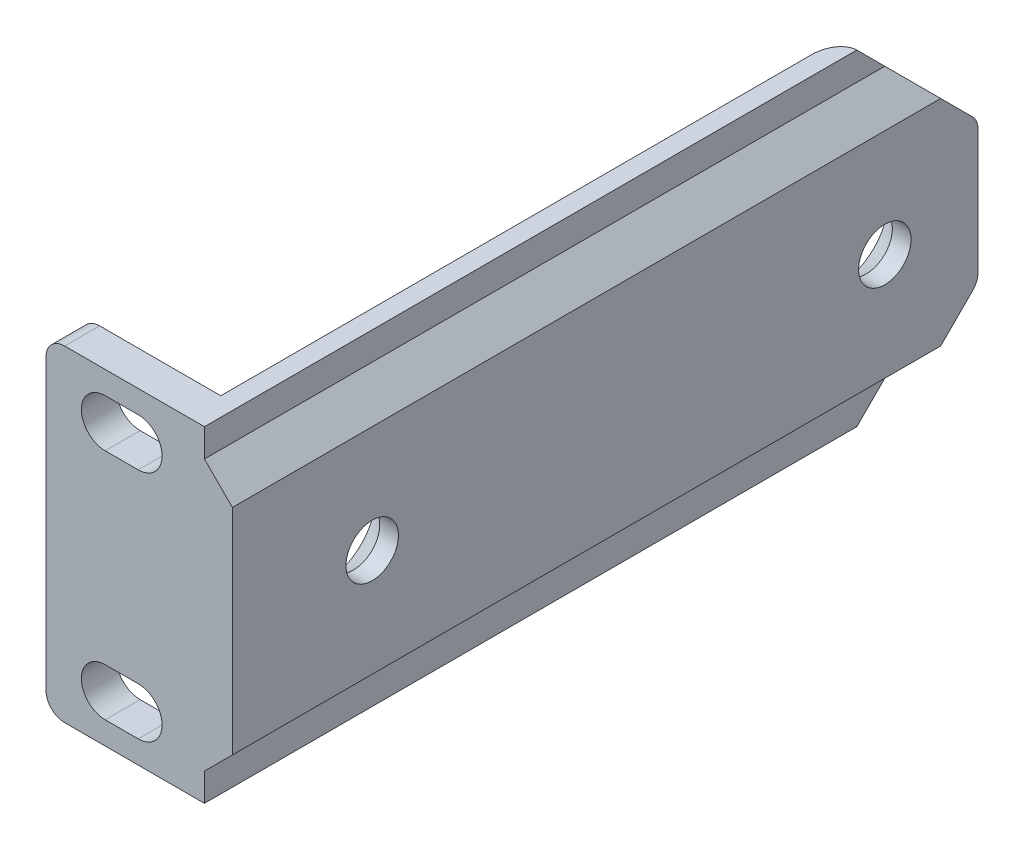
from build123d import *

# Parameters (mm, degrees)
BOSS_EXTRUDE1_DEPTH                           = 22.225
SKETCH2_W                                     = 3.81
SKETCH2_H                                     = 3.81
CUT_EXTRUDE1_DEPTH                            = 108.059192156
CUT_EXTRUDE2_DEPTH                            = 108.059192156
FILLET1_R                                     = 2.54
CSK_FOR_1_4_FLAT_HEAD_MACHINE_SCREW1_AT_COUNT = 2
CSK_FOR_1_4_FLAT_HEAD_MACHINE_SCREW1_AT_PITCH = 69.85
CUT_EXTRUDE3_DEPTH                            = 106.732743864
FILLET2_R                                     = 2.54
CHAMFER1_SIZE                                 = 3.81


with BuildPart() as part:
    # Sketch1 → Boss-Extrude1 (new, symmetric)
    with BuildSketch(Plane(origin=(0, 0, 0), x_dir=(1, 0, 0), z_dir=(0, 1, 0))):
        Polygon((0, 0), (0, 101.6), (-6.35, 101.6), (-6.35, 4.7625), (-25.4, 4.7625), (-25.4, 0), align=None)
    extrude(amount=BOSS_EXTRUDE1_DEPTH, both=True)

    # Sketch2 → Cut-Extrude1 (cut, through all)
    with BuildSketch(Plane.XY):
        with Locations((-1.905, 20.32)):
            Rectangle(SKETCH2_W, SKETCH2_H)
        with Locations((-1.905, -20.32)):
            Rectangle(SKETCH2_W, SKETCH2_H)
    extrude(amount=-CUT_EXTRUDE1_DEPTH, mode=Mode.SUBTRACT)

    # Sketch3 → Cut-Extrude2 (cut, through all)
    with BuildSketch(Plane.XY):
        with BuildLine():
            Line((-12.83335, -19.1262), (-17.32915, -19.1262))
            ThreePointArc((-17.32915, -19.1262), (-20.58035, -15.875), (-17.32915, -12.6238))
            Line((-17.32915, -12.6238), (-12.83335, -12.6238))
            ThreePointArc((-12.83335, -12.6238), (-9.58215, -15.875), (-12.83335, -19.1262))
        make_face()
        with BuildLine():
            Line((-12.83335, 19.1262), (-17.32915, 19.1262))
            ThreePointArc((-17.32915, 19.1262), (-20.58035, 15.875), (-17.32915, 12.6238))
            Line((-17.32915, 12.6238), (-12.83335, 12.6238))
            ThreePointArc((-12.83335, 12.6238), (-9.58215, 15.875), (-12.83335, 19.1262))
        make_face()
    extrude(amount=-CUT_EXTRUDE2_DEPTH, mode=Mode.SUBTRACT)

    # Fillet1
    fillet1_edges = [part.edges().sort_by_distance(p)[0] for p in [
        (-25.4, 22.225, -2.38125),
        (-25.4, -22.225, -2.38125),
    ]]
    fillet(fillet1_edges, radius=FILLET1_R)

    # Sketch5 → CSK for 1/4 Flat Head Machine Screw1 (revolve, cut)
    with BuildSketch(Plane(origin=(-6.35, 0, -19.05), x_dir=(0, 0, 1), z_dir=(0, 1, 0))):
        Polygon((0, 0), (0, 6.35), (3.57124, 6.35), (3.57124, 3.806858607), (6.8804917, 0), align=None)
    csk_for_1_4_flat_head_machine_screw1 = revolve(axis=Axis((-12.7, 0, -19.05), (1, 0, 0)), mode=Mode.SUBTRACT)

    # CSK for 1/4 Flat Head Machine Screw1 at: CSK for 1/4 Flat Head Machine Screw1 ×2
    with Locations(*[(0, 0, -i * CSK_FOR_1_4_FLAT_HEAD_MACHINE_SCREW1_AT_PITCH) for i in range(1, CSK_FOR_1_4_FLAT_HEAD_MACHINE_SCREW1_AT_COUNT)]):
        add(csk_for_1_4_flat_head_machine_screw1, mode=Mode.SUBTRACT)

    # Sketch6 → Cut-Extrude3 (cut, through all)
    with BuildSketch(Plane.ZY.offset(6.35)):
        Polygon((-88.9, -22.225), (-101.6, -22.225), (-101.6, -9.525), align=None)
        Polygon((-101.6, 22.225), (-101.6, 9.525), (-88.9, 22.225), align=None)
    extrude(amount=-CUT_EXTRUDE3_DEPTH, mode=Mode.SUBTRACT)

    # Fillet2
    fillet2_edges = [part.edges().sort_by_distance(p)[0] for p in [
        (-6.35, -15.875, -95.25),
        (-6.35, 0, -101.6),
        (-6.35, 15.875, -95.25),
        (-3.175, 9.525, -101.6),
        (-3.175, -9.525, -101.6),
    ]]
    fillet(fillet2_edges, radius=FILLET2_R)

    # Chamfer1
    chamfer1_edges = [part.edges().sort_by_distance(p)[0] for p in [
        (0, 18.415, -46.355),
        (0, -18.415, -46.355),
    ]]
    chamfer(chamfer1_edges, length=CHAMFER1_SIZE - 0.0001)  # a hair under: the kernel refuses the full size


solid = part.part
